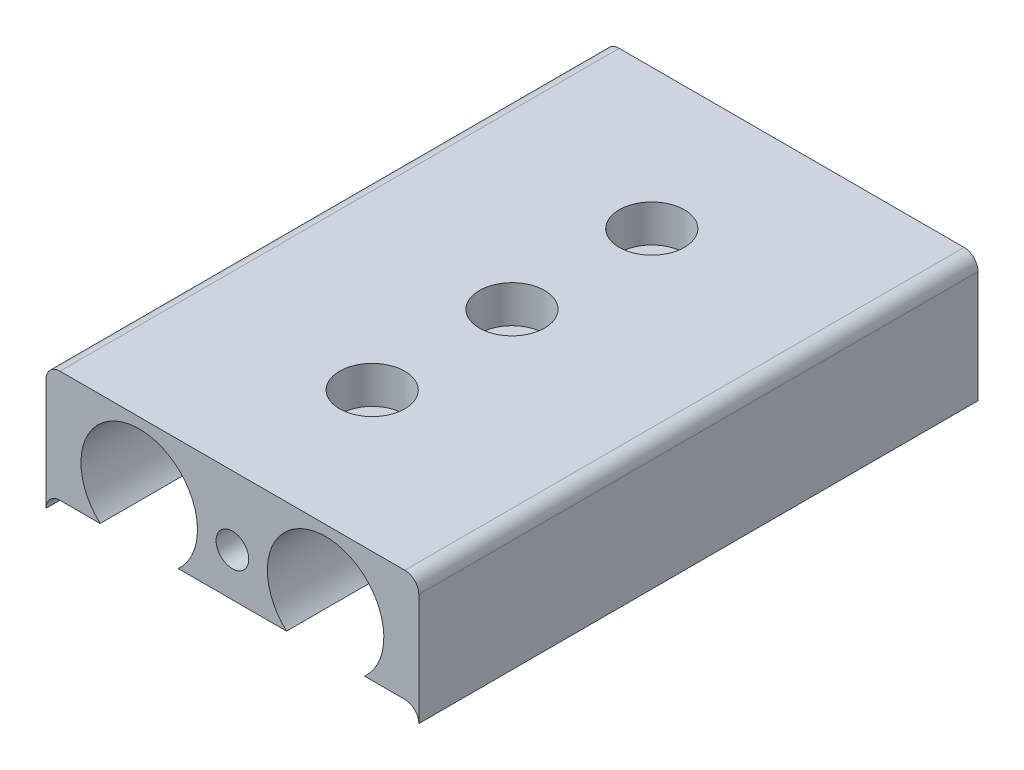
from build123d import *

# Parameters (mm, degrees)
SKETCH_1_R          = 3.5
EXTRUDE_1_DEPTH     = 60
SKETCH_2_R          = 6.25
CUT_EXTRUDE_1_DEPTH = 20
CUT_EXTRUDE_START   = -20
SKETCH_3_R          = 6.25
CUT_EXTRUDE_2_DEPTH = 20
SKETCH_4_R          = 3.5
CUT_EXTRUDE_3_DEPTH = 4
SKETCH_5_R          = 3.5
CUT_EXTRUDE_4_DEPTH = 4
SKETCH_6_R          = 1.75
CUT_EXTRUDE_5_DEPTH = 14
SKETCH_7_R          = 1.75
CUT_EXTRUDE_6_DEPTH = 10
CUT_EXTRUDE_START_2 = -10
SKETCH_8_R          = 1.75
CUT_EXTRUDE_7_DEPTH = 10


with BuildPart() as part:
    # 草图1 → 凸台-拉伸1 (new body)
    with BuildSketch(Plane.XY):
        with BuildLine():
            Line((38.795098039, 43.765686275), (1.795098039, 43.765686275))
            ThreePointArc((1.795098039, 43.765686275), (0.734437867, 43.326346446), (0.295098039, 42.265686275))
            Line((0.295098039, 42.265686275), (0.295098039, 30.265686275))
            ThreePointArc((0.295098039, 30.265686275), (0.734437867, 31.326346446), (1.795098039, 31.765686275))
            Line((1.795098039, 31.765686275), (38.795098039, 31.765686275))
            ThreePointArc((38.795098039, 31.765686275), (39.855758211, 31.326346446), (40.295098039, 30.265686275))
            Line((40.295098039, 30.265686275), (40.295098039, 42.265686275))
            ThreePointArc((40.295098039, 42.265686275), (39.855758211, 43.326346446), (38.795098039, 43.765686275))
        make_face()
        with Locations((30.295098039, 36.405686275)):
            Circle(SKETCH_1_R, mode=Mode.SUBTRACT)
        with Locations((10.295098039, 36.405686275)):
            Circle(SKETCH_1_R, mode=Mode.SUBTRACT)
    extrude(amount=EXTRUDE_1_DEPTH)

    # 草图2 → 切除-拉伸1 (cut)
    with BuildSketch(Plane.XY.offset(60)):
        with Locations((10.295098039, 36.405686275)):
            Circle(SKETCH_2_R)
        with Locations((30.295098039, 36.405686275)):
            Circle(SKETCH_2_R)
    extrude(amount=-CUT_EXTRUDE_1_DEPTH, mode=Mode.SUBTRACT)

    # 草图3 → 切除-拉伸2 (cut)
    with BuildSketch(Plane(origin=(0, 0, 0), x_dir=(-1, 0, 0), z_dir=(0, 0, -1)).offset(CUT_EXTRUDE_START)):
        with Locations((-10.295098039, 36.405686275)):
            Circle(SKETCH_3_R)
        with Locations((-30.295098039, 36.405686275)):
            Circle(SKETCH_3_R)
    extrude(amount=CUT_EXTRUDE_2_DEPTH, mode=Mode.SUBTRACT)

    # 草图4 → 切除-拉伸3 (cut)
    with BuildSketch(Plane(origin=(0, 43.765686275, 0), x_dir=(1, 0, 0), z_dir=(0, 1, 0))):
        with Locations((20.295098039, -30)):
            Circle(SKETCH_4_R)
    extrude(amount=-CUT_EXTRUDE_3_DEPTH, mode=Mode.SUBTRACT)

    # 草图5 → 切除-拉伸4 (cut)
    with BuildSketch(Plane(origin=(0, 43.765686275, 0), x_dir=(1, 0, 0), z_dir=(0, 1, 0))):
        with Locations((20.295098039, -15)):
            Circle(SKETCH_5_R)
        with Locations((20.295098039, -45)):
            Circle(SKETCH_5_R)
    extrude(amount=-CUT_EXTRUDE_4_DEPTH, mode=Mode.SUBTRACT)

    # 草图6 → 切除-拉伸5 (cut)
    with BuildSketch(Plane(origin=(0, 39.765686275, 0), x_dir=(1, 0, 0), z_dir=(0, 1, 0))):
        with Locations((20.295098039, -30)):
            Circle(SKETCH_6_R)
        with Locations((20.295098039, -15)):
            Circle(SKETCH_6_R)
        with Locations((20.295098039, -45)):
            Circle(SKETCH_6_R)
    extrude(amount=-CUT_EXTRUDE_5_DEPTH, mode=Mode.SUBTRACT)

    # 草图7 → 切除-拉伸6 (cut)
    with BuildSketch(Plane.XY.offset(60)):
        with Locations((20.295098039, 36.405686275)):
            Circle(SKETCH_7_R)
    extrude(amount=-CUT_EXTRUDE_6_DEPTH, mode=Mode.SUBTRACT)

    # 草图8 → 切除-拉伸7 (cut)
    with BuildSketch(Plane(origin=(0, 0, 0), x_dir=(-1, 0, 0), z_dir=(0, 0, -1)).offset(CUT_EXTRUDE_START_2)):
        with Locations((-20.295098039, 36.405686275)):
            Circle(SKETCH_8_R)
    extrude(amount=CUT_EXTRUDE_7_DEPTH, mode=Mode.SUBTRACT)


solid = part.part
